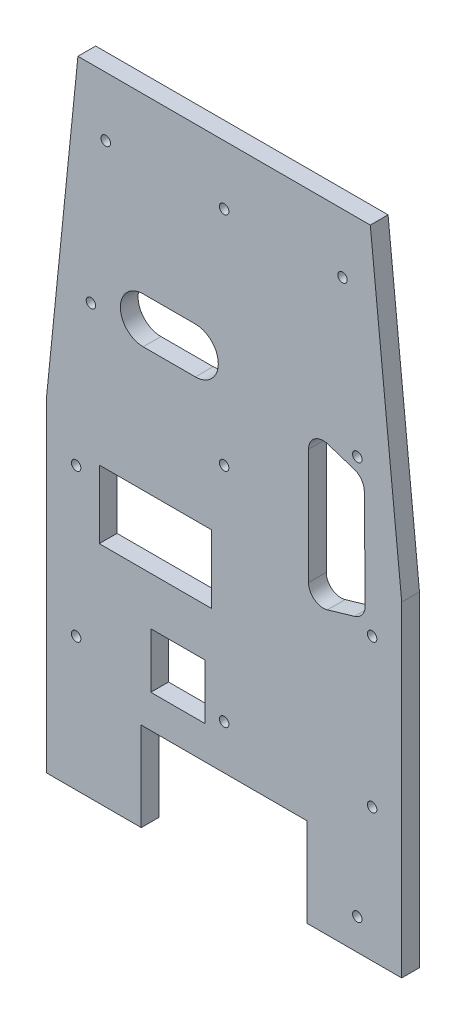
from build123d import *

# Parameters (mm, degrees)
ESQUISSE1_W                    = 120
ESQUISSE1_H                    = 215
BOSS_EXTRU_1_DEPTH             = 6
ESQUISSE2_R                    = 1.6
ENL_V_MAT_EXTRU_1_DEPTH        = 138.798088748
R_P_TITION_LIN_AIRE1_OUTLINE_R = 1.6
R_P_TITION_LIN_AIRE1_DEPTH     = 6
ESQUISSE3_W                    = 38
ESQUISSE3_H                    = 23
ESQUISSE3_W_2                  = 18.381114661
ESQUISSE3_H_2                  = 18.590181779
ENL_V_MAT_EXTRU_2_DEPTH        = 138.798088748
ENL_V_MAT_EXTRU_3_DEPTH        = 138.798088748
CONG_1_R                       = 5
ESQUISSE5_R                    = 1.6
ENL_V_MAT_EXTRU_4_DEPTH        = 10
ESQUISSE6_W                    = 56
ESQUISSE6_H                    = 30
ENL_V_MAT_EXTRU_5_DEPTH        = 138.798088748


# Read off the part's stored shape, not the designer's step: Répétition linéaire1
with BuildPart() as part:
    # Esquisse1 → Boss.-Extru.1 (new body)
    with BuildSketch(Plane.XY):
        with Locations((22.778700537, 2.5)):
            Rectangle(ESQUISSE1_W, ESQUISSE1_H)
    extrude(amount=BOSS_EXTRU_1_DEPTH)

    # Esquisse2 → Enlèv. mat.-Extru.1 (cut, through all)
    with BuildSketch(Plane.XY.offset(6)):
        with Locations((-27.221299463, -60)):
            Circle(ESQUISSE2_R)
    extrude(amount=-ENL_V_MAT_EXTRU_1_DEPTH, mode=Mode.SUBTRACT)

    # Répétition linéaire1 outline → Répétition linéaire1 (cut)
    with BuildSketch(Plane.XY):
        with Locations((-27.221299463, -10)):
            Circle(R_P_TITION_LIN_AIRE1_OUTLINE_R)
        with Locations((-22.221299463, 40)):
            Circle(R_P_TITION_LIN_AIRE1_OUTLINE_R)
        with Locations((-17.221299463, 90)):
            Circle(R_P_TITION_LIN_AIRE1_OUTLINE_R)
        with Locations((22.778700537, -60)):
            Circle(R_P_TITION_LIN_AIRE1_OUTLINE_R)
        with Locations((22.778700537, 15)):
            Circle(R_P_TITION_LIN_AIRE1_OUTLINE_R)
        with Locations((62.778700537, 90)):
            Circle(R_P_TITION_LIN_AIRE1_OUTLINE_R)
        with Locations((67.778700537, 40)):
            Circle(R_P_TITION_LIN_AIRE1_OUTLINE_R)
        with Locations((72.778700537, -10)):
            Circle(R_P_TITION_LIN_AIRE1_OUTLINE_R)
        with Locations((72.778700537, -60)):
            Circle(R_P_TITION_LIN_AIRE1_OUTLINE_R)
        with Locations((22.778700537, 90)):
            Circle(R_P_TITION_LIN_AIRE1_OUTLINE_R)
    extrude(amount=R_P_TITION_LIN_AIRE1_DEPTH, mode=Mode.SUBTRACT)

    # Esquisse3 → Enlèv. mat.-Extru.2 (cut, through all)
    with BuildSketch(Plane(origin=(0, 0, 0), x_dir=(-1, 0, 0), z_dir=(0, 0, -1))):
        with Locations((0.408750369, -17.5)):
            Rectangle(ESQUISSE3_W, ESQUISSE3_H)
        with Locations((-7.196798698, -54.48972052)):
            Rectangle(ESQUISSE3_W_2, ESQUISSE3_H_2)
        with BuildLine():
            Line((4.557875847, 36.021320392), (-13.074694363, 36.021320392))
            ThreePointArc((-13.074694363, 36.021320392), (-20.807462052, 43.75408808), (-13.074694363, 51.486855768))
            Line((-13.074694363, 51.486855768), (4.557875847, 51.486855768))
            ThreePointArc((4.557875847, 51.486855768), (12.290643535, 43.75408808), (4.557875847, 36.021320392))
        make_face()
        Polygon((-51.286994849, -11.69900166), (-51.286994849, 40.852954993), (-70.100011596, 34.728797636), (-70.479177032, -6.090187837), align=None)
        with BuildLine():
            Line((-30.778700537, -101), (-30.778700537, -105))
            Line((-30.778700537, -105), (-14.778700537, -105))
            Line((-14.778700537, -105), (-14.778700537, -101))
            ThreePointArc((-14.778700537, -101), (-22.778700537, -93), (-30.778700537, -101))
        make_face()
    extrude(amount=-ENL_V_MAT_EXTRU_2_DEPTH, mode=Mode.SUBTRACT)

    # Esquisse4 → Enlèv. mat.-Extru.3 (cut, through all)
    with BuildSketch(Plane.XY.offset(6)):
        Polygon((-37.221299463, 110), (-37.221299463, 4.99999922), (-26.615238451, 110), align=None)
        Polygon((72.172639526, 110), (82.778700537, 110), (82.778700537, 4.99999922), align=None)
    extrude(amount=-ENL_V_MAT_EXTRU_3_DEPTH, mode=Mode.SUBTRACT)

    # Congé1
    cong_1_edges = [part.edges().sort_by_distance(p)[0] for p in [
        (70.100011596, 34.728797636, 3),
        (51.286994849, 40.852954993, 3),
        (51.286994849, -11.69900166, 3),
        (70.479177032, -6.090187837, 3),
    ]]
    fillet(cong_1_edges, radius=CONG_1_R)

    # Esquisse5 → Enlèv. mat.-Extru.4 (cut)
    with BuildSketch(Plane.XY.offset(6)):
        with Locations((67.778700537, -94.54)):
            Circle(ESQUISSE5_R)
    extrude(amount=-ENL_V_MAT_EXTRU_4_DEPTH, mode=Mode.SUBTRACT)

    # Esquisse6 → Enlèv. mat.-Extru.5 (cut, through all)
    with BuildSketch(Plane.XY.offset(6)):
        with Locations((22.778700537, -90)):
            Rectangle(ESQUISSE6_W, ESQUISSE6_H)
    extrude(amount=-ENL_V_MAT_EXTRU_5_DEPTH, mode=Mode.SUBTRACT)


solid = part.part
